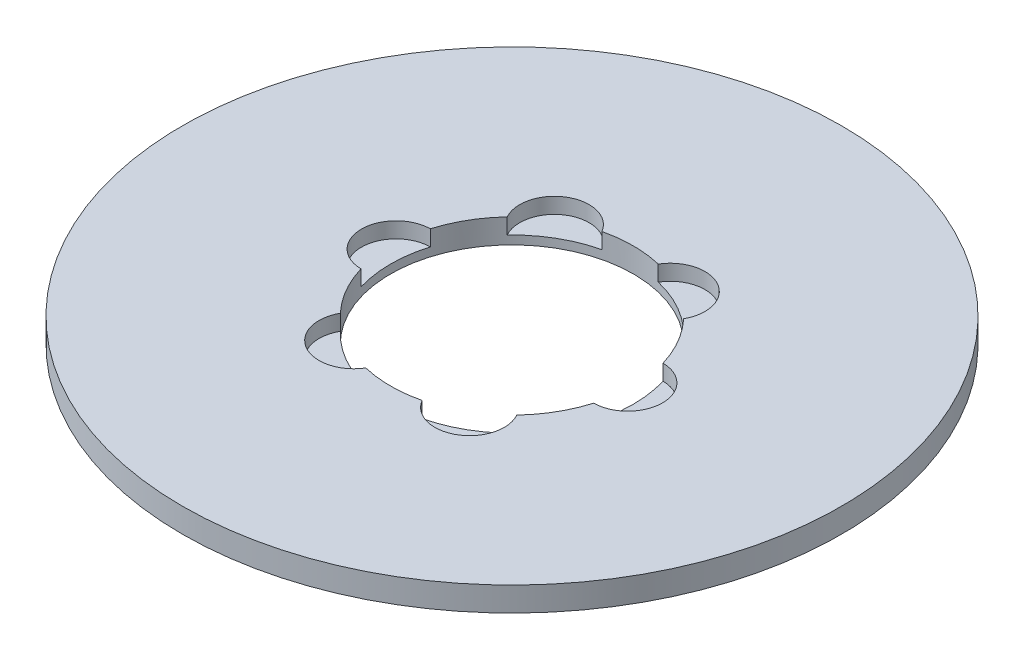
from build123d import *

# Parameters (mm, degrees)
SKETCH1_R           = 95
BOSS_EXTRUDE1_DEPTH = 7
SKETCH2_R           = 35
CUT_EXTRUDE1_DEPTH  = 135.532523949
SKETCH3_R           = 10
CUT_EXTRUDE2_DEPTH  = 4.518868684
CIRPATTERN1_COUNT   = 6


with BuildPart() as part:
    # Sketch1 → Boss-Extrude1 (new body)
    with BuildSketch(Plane(origin=(0, 0, 0), x_dir=(1, 0, 0), z_dir=(0, 1, 0))):
        Circle(SKETCH1_R)
    extrude(amount=BOSS_EXTRUDE1_DEPTH)

    # Sketch2 → Cut-Extrude1 (cut, through all)
    with BuildSketch(Plane(origin=(0, 0, 0), x_dir=(1, 0, 0), z_dir=(0, 1, 0))):
        Circle(SKETCH2_R)
    extrude(amount=CUT_EXTRUDE1_DEPTH, mode=Mode.SUBTRACT)

    # Sketch3 → Cut-Extrude2 (cut)
    with BuildSketch(Plane(origin=(0, 7, 0), x_dir=(1, 0, 0), z_dir=(0, 1, 0))):
        with Locations((-33.40367361, 0)):
            Circle(SKETCH3_R)
    cut_extrude2 = extrude(amount=-CUT_EXTRUDE2_DEPTH, mode=Mode.SUBTRACT)

    # CirPattern1: Cut-Extrude2 ×6 about axis
    cirpattern1_axis = Axis((0, 0, 0), (0, 1, 0))
    for i in range(1, CIRPATTERN1_COUNT):
        add(cut_extrude2.rotate(cirpattern1_axis, i * 360 / CIRPATTERN1_COUNT), mode=Mode.SUBTRACT)


solid = part.part
